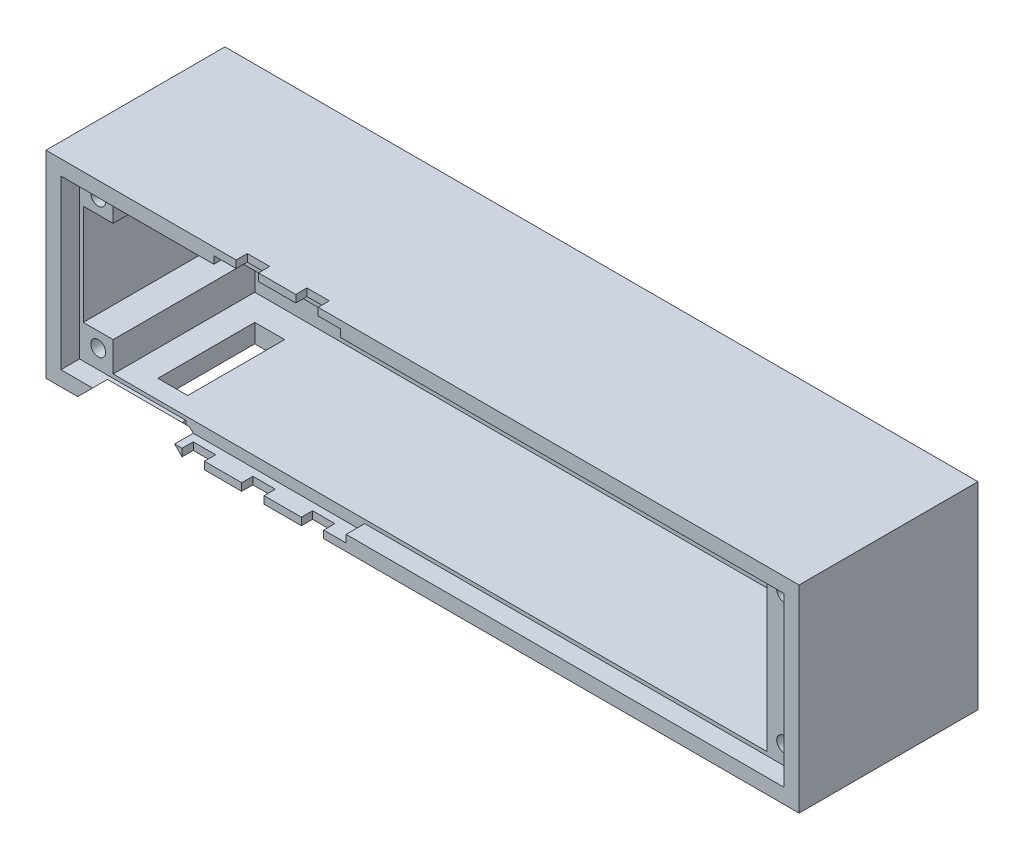
from build123d import *

# Parameters (mm, degrees)
SKETCH_1_W                = 101
SKETCH_1_H                = 26.5
EXTRUDE_1_DEPTH           = 2.5
SKETCH_2_W                = 101
SKETCH_2_H                = 26.5
SKETCH_2_W_2              = 96
SKETCH_2_H_2              = 21.5
EXTRUDE_2_DEPTH           = 21.5
SKETCH_3_W                = 4
SKETCH_3_H                = 4
EXTRUDE_3_DEPTH           = 19
SKETCH_5_R                = 1
CUT_EXTRUDE_1_DEPTH       = 12
SKETCH_6_W                = 45
SKETCH_6_H                = 13
CUT_EXTRUDE_2_DEPTH       = 1.5
SKETCH_7_W                = 4
SKETCH_7_H                = 13
CUT_EXTRUDE_3_DEPTH       = 1.5
SKETCH_8_W                = 97
SKETCH_8_H                = 22.5
CUT_EXTRUDE_4_DEPTH       = 2.5
CUT_EXTRUDE_5_REACH       = 109.141
SKETCH_9_W                = 10
SKETCH_9_H                = 2
SKETCH_9_W_2              = 3
SKETCH_9_H_2              = 1.5
CHAMFER_1_SIZE            = 2
CUT_EXTRUDE_6_REACH       = 109.141
SKETCH_11_W               = 3
SKETCH_11_H               = 1.5
CUT_EXTRUDE_7_REACH       = 109.141
SKETCH_12_W               = 3
SKETCH_12_H               = 3
SKETCH_14_W               = 4
SKETCH_14_H               = 5.5
SKETCH_14_W_2             = 3
SKETCH_14_H_2             = 3
EXTRUDE_4_DEPTH           = 5
CUT_EXTRUDE_8_REACH       = 109.141
SKETCH_13_W               = 3
SKETCH_13_H               = 3
SKETCH_15_W               = 4
SKETCH_15_H               = 5.5
EXTRUDE_5_DEPTH           = 1.5
SKETCH_16_W               = 19
SKETCH_16_H               = 21.5
EXTRUDE_6_DEPTH           = 1
CUT_EXTRUDE_START         = -2.5
CUT_EXTRUDE_9_OUTLINE_W   = 17
CUT_EXTRUDE_9_OUTLINE_H   = 1
CUT_EXTRUDE_9_OUTLINE_W_2 = 24
CUT_EXTRUDE_9_DEPTH       = 2.5


# Read off the part's stored shape, not the designer's step: 切除-拉伸9
with BuildPart() as part:
    # 草图1 → 凸台-拉伸1 (new body)
    with BuildSketch(Plane.XY):
        with Locations((50.5, 13.25)):
            Rectangle(SKETCH_1_W, SKETCH_1_H)
    extrude(amount=EXTRUDE_1_DEPTH)

    # 草图2 → 凸台-拉伸2 (add)
    with BuildSketch(Plane.XY.offset(2.5)):
        with Locations((50.5, 13.25)):
            Rectangle(SKETCH_2_W, SKETCH_2_H)
        with Locations((50.5, 13.25)):
            Rectangle(SKETCH_2_W_2, SKETCH_2_H_2, mode=Mode.SUBTRACT)
    extrude(amount=EXTRUDE_2_DEPTH)

    # 草图3 → 凸台-拉伸3 (add)
    with BuildSketch(Plane.XY.offset(2.5)):
        with Locations((4.5, 22)):
            Rectangle(SKETCH_3_W, SKETCH_3_H)
        with Locations((4.5, 4.5)):
            Rectangle(SKETCH_3_W, SKETCH_3_H)
        Polygon((98.5, 24), (95.195835911, 24), (95.195835911, 20), (95.195835911, 6.5), (95.195835911, 2.5), (98.5, 2.5), (98.5, 8.754439991), (98.5, 17.745560009), align=None)
    extrude(amount=EXTRUDE_3_DEPTH)

    # 草图5 → 切除-拉伸1 (cut)
    with BuildSketch(Plane.XY.offset(21.5)):
        with Locations((4.5, 22)):
            Circle(SKETCH_5_R)
        with Locations((4.5, 4.5)):
            Circle(SKETCH_5_R)
        with Locations((96.5, 22)):
            Circle(SKETCH_5_R)
        with Locations((96.5, 4.5)):
            Circle(SKETCH_5_R)
    extrude(amount=-CUT_EXTRUDE_1_DEPTH, mode=Mode.SUBTRACT)

    # 草图6 → 切除-拉伸2 (cut)
    with BuildSketch(Plane.XZ):
        with Locations((32.5, 12.5)):
            Rectangle(SKETCH_6_W, SKETCH_6_H)
    extrude(amount=-CUT_EXTRUDE_2_DEPTH, mode=Mode.SUBTRACT)

    # 草图7 → 切除-拉伸3 (cut)
    with BuildSketch(Plane.XZ.offset(-1.5)):
        with Locations((12, 12.5)):
            Rectangle(SKETCH_7_W, SKETCH_7_H)
    extrude(amount=-CUT_EXTRUDE_3_DEPTH, mode=Mode.SUBTRACT)

    # 草图8 → 切除-拉伸4 (cut)
    with BuildSketch(Plane.XY.offset(24)):
        with Locations((50.5, 13.25)):
            Rectangle(SKETCH_8_W, SKETCH_8_H)
    extrude(amount=-CUT_EXTRUDE_4_DEPTH, mode=Mode.SUBTRACT)

    # 草图9 → 切除-拉伸5 (cut, up to next)
    with BuildSketch(Plane.XZ, mode=Mode.PRIVATE) as cut_extrude_5_sk1:
        with Locations((11.25, 23)):
            Rectangle(SKETCH_9_W, SKETCH_9_H)
    cut_extrude_5_tool1 = extrude(cut_extrude_5_sk1.sketch, amount=-CUT_EXTRUDE_5_REACH, mode=Mode.PRIVATE) & part.part
    # 草图9 → 切除-拉伸5 (cut, up to next)
    with BuildSketch(Plane.XZ, mode=Mode.PRIVATE) as cut_extrude_5_sk2:
        with Locations((19.75, 23.25)):
            Rectangle(SKETCH_9_W_2, SKETCH_9_H_2)
    cut_extrude_5_tool2 = extrude(cut_extrude_5_sk2.sketch, amount=-CUT_EXTRUDE_5_REACH, mode=Mode.PRIVATE) & part.part
    # 草图9 → 切除-拉伸5 (cut, up to next)
    with BuildSketch(Plane.XZ, mode=Mode.PRIVATE) as cut_extrude_5_sk3:
        with Locations((27.75, 23.25)):
            Rectangle(SKETCH_9_W_2, SKETCH_9_H_2)
    cut_extrude_5_tool3 = extrude(cut_extrude_5_sk3.sketch, amount=-CUT_EXTRUDE_5_REACH, mode=Mode.PRIVATE) & part.part
    # 草图9 → 切除-拉伸5 (cut, up to next)
    with BuildSketch(Plane.XZ, mode=Mode.PRIVATE) as cut_extrude_5_sk4:
        with Locations((35.75, 23.25)):
            Rectangle(SKETCH_9_W_2, SKETCH_9_H_2)
    cut_extrude_5_tool4 = extrude(cut_extrude_5_sk4.sketch, amount=-CUT_EXTRUDE_5_REACH, mode=Mode.PRIVATE) & part.part
    add(cut_extrude_5_tool1.solids().sort_by_distance((11.25, 0, 23))[0], mode=Mode.SUBTRACT)
    add(cut_extrude_5_tool2.solids().sort_by_distance((19.75, 0, 23.25))[0], mode=Mode.SUBTRACT)
    add(cut_extrude_5_tool3.solids().sort_by_distance((27.75, 0, 23.25))[0], mode=Mode.SUBTRACT)
    add(cut_extrude_5_tool4.solids().sort_by_distance((35.75, 0, 23.25))[0], mode=Mode.SUBTRACT)

    # 倒角1
    chamfer_1_edges = [part.edges().sort_by_distance(p)[0] for p in [
        (16.25, 0, 23),
        (11.25, 0, 22),
        (6.25, 0, 23),
    ]]
    chamfer(chamfer_1_edges, length=CHAMFER_1_SIZE - 0.0001)  # a hair under: the kernel refuses the full size

    # 草图11 → 切除-拉伸6 (cut, up to next)
    with BuildSketch(Plane(origin=(0, 26.5, 0), x_dir=(1, 0, 0), z_dir=(0, 1, 0)), mode=Mode.PRIVATE) as cut_extrude_6_sk1:
        with Locations((27, -23.25)):
            Rectangle(SKETCH_11_W, SKETCH_11_H)
    cut_extrude_6_tool1 = extrude(cut_extrude_6_sk1.sketch, amount=-CUT_EXTRUDE_6_REACH, mode=Mode.PRIVATE) & part.part
    # 草图11 → 切除-拉伸6 (cut, up to next)
    with BuildSketch(Plane(origin=(0, 26.5, 0), x_dir=(1, 0, 0), z_dir=(0, 1, 0)), mode=Mode.PRIVATE) as cut_extrude_6_sk2:
        with Locations((35, -23.25)):
            Rectangle(SKETCH_11_W, SKETCH_11_H)
    cut_extrude_6_tool2 = extrude(cut_extrude_6_sk2.sketch, amount=-CUT_EXTRUDE_6_REACH, mode=Mode.PRIVATE) & part.part
    add(cut_extrude_6_tool1.solids().sort_by_distance((27, 26.5, 23.25))[0], mode=Mode.SUBTRACT)
    add(cut_extrude_6_tool2.solids().sort_by_distance((35, 26.5, 23.25))[0], mode=Mode.SUBTRACT)

    # 草图12 → 切除-拉伸7 (cut, up to next)
    with BuildSketch(Plane(origin=(0, 0, 0), x_dir=(-1, 0, 0), z_dir=(0, 0, -1)), mode=Mode.PRIVATE) as cut_extrude_7_sk1:
        with Locations((-4.5, 17)):
            Rectangle(SKETCH_12_W, SKETCH_12_H)
    cut_extrude_7_tool1 = extrude(cut_extrude_7_sk1.sketch, amount=-CUT_EXTRUDE_7_REACH, mode=Mode.PRIVATE) & part.part
    add(cut_extrude_7_tool1.solids().sort_by_distance((4.5, 17, 0))[0], mode=Mode.SUBTRACT)

    # 草图14 → 凸台-拉伸4 (add)
    with BuildSketch(Plane.XY.offset(2.5)):
        with Locations((4.5, 17.25)):
            Rectangle(SKETCH_14_W, SKETCH_14_H)
        with Locations((4.5, 17)):
            Rectangle(SKETCH_14_W_2, SKETCH_14_H_2, mode=Mode.SUBTRACT)
    extrude(amount=EXTRUDE_4_DEPTH)

    # 草图13 → 切除-拉伸8 (cut, up to next)
    with BuildSketch(Plane.ZY, mode=Mode.PRIVATE) as cut_extrude_8_sk1:
        with Locations((4.5, 17)):
            Rectangle(SKETCH_13_W, SKETCH_13_H)
    cut_extrude_8_tool1 = extrude(cut_extrude_8_sk1.sketch, amount=-CUT_EXTRUDE_8_REACH, mode=Mode.PRIVATE) & part.part
    add(cut_extrude_8_tool1.solids().sort_by_distance((0, 17, 4.5))[0], mode=Mode.SUBTRACT)

    # 草图15 → 凸台-拉伸5 (add)
    with BuildSketch(Plane.XY.offset(7.5)):
        with Locations((4.5, 17.25)):
            Rectangle(SKETCH_15_W, SKETCH_15_H)
    extrude(amount=-EXTRUDE_5_DEPTH)

    # 草图16 → 凸台-拉伸6 (add)
    with BuildSketch(Plane.ZY.offset(-95.195835911)):
        with Locations((12, 13.25)):
            Rectangle(SKETCH_16_W, SKETCH_16_H)
    extrude(amount=EXTRUDE_6_DEPTH)

    # 切除-拉伸9 outline → 切除-拉伸9 (cut)
    with BuildSketch(Plane.XY.offset(24).offset(CUT_EXTRUDE_START)):
        with Locations((31, 25)):
            Rectangle(CUT_EXTRUDE_9_OUTLINE_W, CUT_EXTRUDE_9_OUTLINE_H)
        with Locations((28.25, 1.5)):
            Rectangle(CUT_EXTRUDE_9_OUTLINE_W_2, CUT_EXTRUDE_9_OUTLINE_H)
    extrude(amount=CUT_EXTRUDE_9_DEPTH, mode=Mode.SUBTRACT)


solid = part.part
